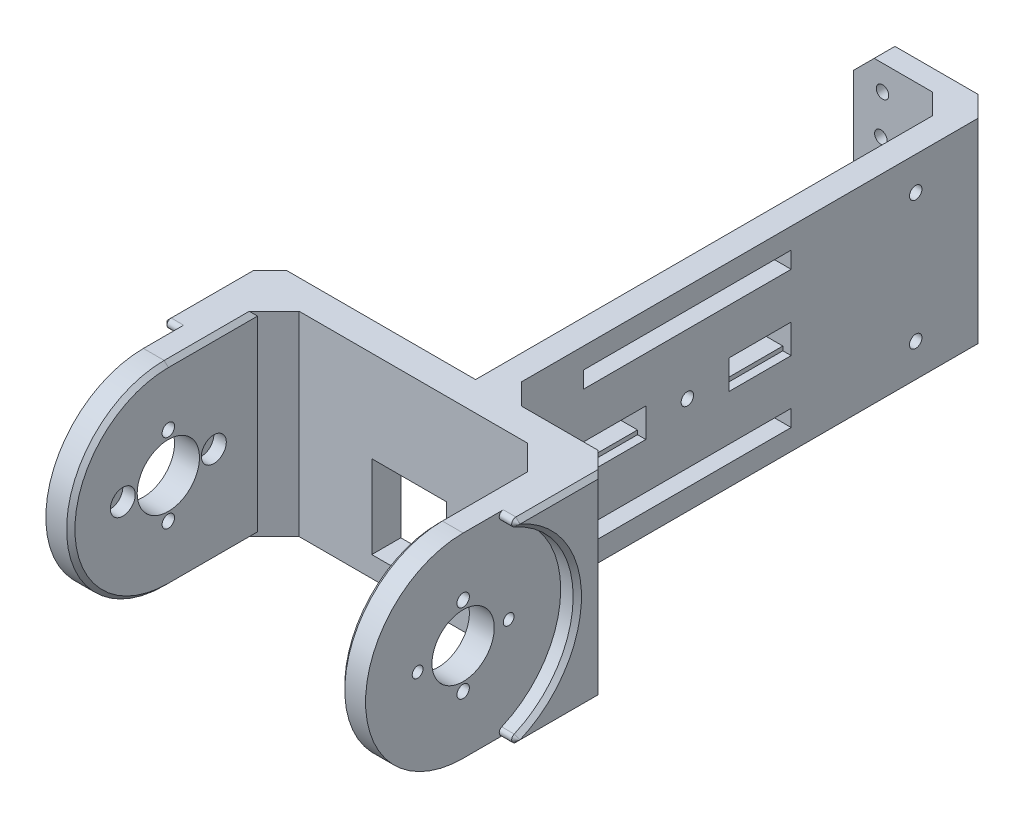
from build123d import *

# Parameters (mm, degrees)
BOSS_EXTRUDE1_DEPTH      = 47
SKETCH4_R                = 7.5
SKETCH4_R_2              = 1.3
SKETCH4_R_3              = 1.5
CUT_EXTRUDE1_DEPTH       = 178.603828403
BOSS_EXTRUDE3_START      = 4
BOSS_EXTRUDE3_DEPTH      = 4
BOSS_EXTRUDE4_DEPTH      = 4
CHAMFER2_SIZE            = 5
CHAMFER3_SIZE            = 5
FILLET1_START            = -43
FILLET1_DEPTH            = 5.085854664
FILLET1_START_2          = 39.085854664
FILLET1_2_DEPTH          = 4.914145336
SKETCH8_W                = 18
SKETCH8_H                = 20
CUT_EXTRUDE2_DEPTH       = 22
CHAMFER7_SIZE            = 5
SKETCH11_W               = 13.612021307
SKETCH11_H               = 35
CUT_EXTRUDE6_DEPTH       = 136.887419845
CHAMFER8_SIZE            = 5
CUT_EXTRUDE7_DEPTH       = 10
CUT_EXTRUDE7_DEPTH_BACK  = 12
SKETCH9_W                = 4
SKETCH9_H                = 21
SKETCH9_R                = 1.5
SKETCH9_6_W              = 12
SKETCH9_6_H              = 21
SKETCH9_6_R              = 1.5
CUT_EXTRUDE8_DEPTH       = 1
SKETCH14_R               = 1.5
SKETCH14_W               = 15
SKETCH14_H               = 5
SKETCH14_W_2             = 50
SKETCH14_H_2             = 4
CUT_EXTRUDE9_DEPTH       = 70
SKETCH15_W               = 15
SKETCH15_H               = 7
CUT_EXTRUDE10_DEPTH      = 2
CUT_EXTRUDE12_DEPTH      = 68
CUT_EXTRUDE12_DEPTH_BACK = 3
SKETCH16_R               = 3
CHAMFER9_SIZE            = 1
CHAMFER10_SIZE           = 1
SKETCH17_R               = 1.5
CUT_EXTRUDE13_DEPTH      = 10
CHAMFER11_SIZE           = 5
SKETCH18_R               = 1.5
CUT_EXTRUDE14_DEPTH      = 10


with BuildPart() as part:
    # Sketch1 → Boss-Extrude1 (new body)
    with BuildSketch(Plane(origin=(0, 0, 0), x_dir=(1, 0, 0), z_dir=(0, 1, 0))):
        Polygon((-31.914145336, -24.01268071), (-31.914145336, 25.98731929), (33.085854664, 25.98731929), (33.085854664, -24.01268071), (39.085854664, -24.01268071), (39.085854664, 32.98731929), (14.585854664, 32.98731929), (14.585854664, 152.98731929), (-15.414145336, 152.98731929), (-15.414145336, 147.98731929), (8.585854664, 147.98731929), (8.585854664, 32.98731929), (-37.914145336, 32.98731929), (-37.914145336, -24.01268071), align=None)
    extrude(amount=BOSS_EXTRUDE1_DEPTH)

    # Sketch4 → Cut-Extrude1 (cut, through all)
    with BuildSketch(Plane.ZY.offset(37.914145336)):
        with BuildLine():
            Line((24.01268071, 0), (24.01268071, 23.5))
            ThreePointArc((24.01268071, 23.5), (17.129690086, 6.88299066), (0.512680761, 0))
            Line((0.512680761, 0), (24.01268071, 0))
        make_face()
        with BuildLine():
            ThreePointArc((0.51268071, 47), (17.129690068, 40.117009358), (24.01268071, 23.5))
            Line((24.01268071, 23.5), (24.01268071, 47))
            Line((24.01268071, 47), (0.51268071, 47))
        make_face()
        with Locations((0.51268071, 23.5)):
            Circle(SKETCH4_R)
        with Locations((-10.44731929, 23.5)):
            Circle(SKETCH4_R_2)
        with Locations((11.472990927, 23.5)):
            Circle(SKETCH4_R_2)
        with Locations((0.51268071, 13.975)):
            Circle(SKETCH4_R_3)
        with Locations((0.51268071, 33.025)):
            Circle(SKETCH4_R_3)
    extrude(amount=-CUT_EXTRUDE1_DEPTH, mode=Mode.SUBTRACT)

    # Sketch4<4> → Boss-Extrude3 (add)
    with BuildSketch(Plane.ZY.offset(37.914145336).offset(BOSS_EXTRUDE3_START)):
        with BuildLine():
            ThreePointArc((0.512680761, 0), (-22.98731929, 23.499999975), (0.51268071, 47))
            Line((0.51268071, 47), (-32.98731929, 47))
            Line((-32.98731929, 47), (-32.98731929, 0))
            Line((-32.98731929, 0), (0.512680761, 0))
        make_face()
    extrude(amount=-BOSS_EXTRUDE3_DEPTH)

    # Sketch6 → Boss-Extrude4 (add)
    with BuildSketch(Plane(origin=(39.085854664, 0, 0), x_dir=(0, 0, -1), z_dir=(1, 0, 0))):
        with BuildLine():
            ThreePointArc((-0.51268071, 47), (16.104328648, 40.117009358), (22.98731929, 23.5))
            ThreePointArc((22.98731929, 23.5), (16.104328648, 6.882990642), (-0.51268071, 0))
            Line((-0.51268071, 0), (32.98731929, 0))
            Line((32.98731929, 0), (32.98731929, 47))
            Line((32.98731929, 47), (-0.51268071, 47))
        make_face()
    extrude(amount=BOSS_EXTRUDE4_DEPTH)

    # Chamfer2
    chamfer2_edges = [part.edges().sort_by_distance(p)[0] for p in [
        (-41.914145336, 23.5, -32.98731929),
        (43.085854664, 23.5, -32.98731929),
    ]]
    chamfer(chamfer2_edges, length=CHAMFER2_SIZE)

    # Chamfer3
    chamfer3_edges = [part.edges().sort_by_distance(p)[0] for p in [
        (33.085854664, 23.5, -25.98731929),
        (-31.914145336, 23.5, -25.98731929),
    ]]
    chamfer(chamfer3_edges, length=CHAMFER3_SIZE)

    # Fillet1: read off the stored shape, not the designer's step
    # Fillet1 outline → Fillet1 (cut)
    with BuildSketch(Plane.YZ.offset(FILLET1_START)):
        with BuildLine():
            ThreePointArc((0, -9.182679005), (0.797969491, -8.203299776), (1.918367347, -8.786950037))
            ThreePointArc((1.918367347, -8.786950037), (0.484588127, -4.235036249), (0, 0.51268071))
            Line((0, 0.51268071), (0, -9.182679005))
        make_face()
        with BuildLine():
            ThreePointArc((47, 0.51268071), (46.515411873, -4.235036249), (45.081632653, -8.786950037))
            ThreePointArc((45.081632653, -8.786950037), (46.202030509, -8.203299776), (47, -9.182679005))
            Line((47, -9.182679005), (47, 0.51268071))
        make_face()
    extrude(amount=FILLET1_DEPTH, mode=Mode.SUBTRACT)

    # Fillet1 2 outline → Fillet1 2 (cut)
    with BuildSketch(Plane.YZ.offset(FILLET1_START_2)):
        with BuildLine():
            ThreePointArc((0, -9.182679005), (0.797969491, -8.203299776), (1.918367347, -8.786950037))
            ThreePointArc((1.918367347, -8.786950037), (0.484588127, -4.235036249), (0, 0.51268071))
            Line((0, 0.51268071), (0, -9.182679005))
        make_face()
        with BuildLine():
            ThreePointArc((47, 0.51268071), (46.515411873, -4.235036249), (45.081632653, -8.786950037))
            ThreePointArc((45.081632653, -8.786950037), (46.202030509, -8.203299776), (47, -9.182679005))
            Line((47, -9.182679005), (47, 0.51268071))
        make_face()
    extrude(amount=FILLET1_2_DEPTH, mode=Mode.SUBTRACT)

    # Sketch8 → Cut-Extrude2 (cut)
    with BuildSketch(Plane(origin=(0, 0, -32.98731929), x_dir=(-1, 0, 0), z_dir=(0, 0, -1))):
        with Locations((0.414145336, 15)):
            Rectangle(SKETCH8_W, SKETCH8_H)
    extrude(amount=-CUT_EXTRUDE2_DEPTH, mode=Mode.SUBTRACT)

    # Chamfer7
    chamfer7_edges = [part.edges().sort_by_distance(p)[0] for p in [
        (14.585854664, 23.5, -32.98731929),
    ]]
    chamfer(chamfer7_edges, length=CHAMFER7_SIZE)

    # Sketch11 → Cut-Extrude6 (cut, through all)
    with BuildSketch(Plane(origin=(0, 0, -32.98731929), x_dir=(-1, 0, 0), z_dir=(0, 0, -1))):
        with Locations((-21.391865318, 23.5)):
            Rectangle(SKETCH11_W, SKETCH11_H)
    extrude(amount=CUT_EXTRUDE6_DEPTH, mode=Mode.SUBTRACT)

    # Chamfer8
    chamfer8_edges = [part.edges().sort_by_distance(p)[0] for p in [
        (8.585854664, 23.5, -147.98731929),
        (14.585854664, 23.5, -152.98731929),
    ]]
    chamfer(chamfer8_edges, length=CHAMFER8_SIZE)

    # Sketch9 → Cut-Extrude7 (cut, two sides: drawn at the far end of the back side and taken through both)
    with BuildSketch(Plane(origin=(155.073173954, 0, -152.98731929), x_dir=(1, 0, 0), z_dir=(0, 0, 1)).offset(-CUT_EXTRUDE7_DEPTH_BACK)):
        with Locations((-152.48731929, 23.5)):
            Rectangle(SKETCH9_W, SKETCH9_H)
        with Locations(Location((-163.88731929, 31.4, 0), (0, 0, 180))):
            Circle(SKETCH9_R)
        with Locations(Location((-163.88731929, 15.6, 0), (0, 0, 180))):
            Circle(SKETCH9_R)
    extrude(amount=CUT_EXTRUDE7_DEPTH + CUT_EXTRUDE7_DEPTH_BACK, mode=Mode.SUBTRACT)

    # Sketch9<6> → Cut-Extrude8 (cut)
    # profile 1 of 2: a face of its own
    with BuildSketch(Plane(origin=(155.073173954, 0, -152.98731929), x_dir=(1, 0, 0), z_dir=(0, 0, 1))):
        with Locations((-160.48731929, 23.5)):
            Rectangle(SKETCH9_6_W, SKETCH9_6_H)
        with Locations(Location((-163.88731929, 15.6, 0), (0, 0, 180))):
            Circle(SKETCH9_6_R, mode=Mode.SUBTRACT)
        with Locations(Location((-163.88731929, 31.4, 0), (0, 0, 180))):
            Circle(SKETCH9_6_R, mode=Mode.SUBTRACT)
    # profile 2 of 2: a face of its own
    with BuildSketch(Plane(origin=(155.073173954, 0, -152.98731929), x_dir=(1, 0, 0), z_dir=(0, 0, 1))):
        Polygon((-167.48731929, 35), (-150.48731929, 35), (-150.48731929, 34), (-166.48731929, 34), (-166.48731929, 13), (-150.48731929, 13), (-150.48731929, 12), (-167.48731929, 12), align=None)
    extrude(amount=CUT_EXTRUDE8_DEPTH, mode=Mode.SUBTRACT)

    # Sketch14 → Cut-Extrude9 (cut)
    with BuildSketch(Plane.ZY.offset(-8.585854664)):
        with Locations((-77.98731929, 23.5)):
            Circle(SKETCH14_R)
        with Locations((-95.48731929, 23.5)):
            Rectangle(SKETCH14_W, SKETCH14_H)
        with Locations((-60.48731929, 23.5)):
            Rectangle(SKETCH14_W, SKETCH14_H)
        with Locations((-77.98731929, 7)):
            Rectangle(SKETCH14_W_2, SKETCH14_H_2)
        with Locations((-77.98731929, 40)):
            Rectangle(SKETCH14_W_2, SKETCH14_H_2)
    extrude(amount=-CUT_EXTRUDE9_DEPTH, mode=Mode.SUBTRACT)

    # Sketch15 → Cut-Extrude10 (cut)
    with BuildSketch(Plane(origin=(14.585854664, 0, 0), x_dir=(0, 0, -1), z_dir=(1, 0, 0))):
        with Locations((95.48731929, 23.5)):
            Rectangle(SKETCH15_W, SKETCH15_H)
        with Locations((60.48731929, 23.5)):
            Rectangle(SKETCH15_W, SKETCH15_H)
    extrude(amount=-CUT_EXTRUDE10_DEPTH, mode=Mode.SUBTRACT)

    # Sketch16 → Cut-Extrude12 (cut, two sides: drawn at the far end of the back side and taken through both)
    with BuildSketch(Plane(origin=(-31.914145336, 0, 0), x_dir=(0, 0, -1), z_dir=(1, 0, 0)).offset(-CUT_EXTRUDE12_DEPTH_BACK)):
        with Locations((10.44731929, 23.5)):
            Circle(SKETCH16_R)
        with Locations((-11.472990927, 23.5)):
            Circle(SKETCH16_R)
    extrude(amount=CUT_EXTRUDE12_DEPTH + CUT_EXTRUDE12_DEPTH_BACK, mode=Mode.SUBTRACT)

    # Chamfer9
    chamfer9_edges = [part.edges().sort_by_distance(p)[0] for p in [
        (33.085854664, 0, -10.237319264),
        (33.085854664, 47, -10.23731929),
        (-31.914145336, 47, -10.23731929),
        (-31.914145336, 23.500000025, 24.01268071),
        (33.085854664, 23.500000025, 24.01268071),
        (-31.914145336, 0, -10.237319264),
    ]]
    chamfer(chamfer9_edges, length=CHAMFER9_SIZE)

    # Chamfer10
    chamfer10_edges = [part.edges().sort_by_distance(p)[0] for p in [
        (-41.914145336, 0, -18.584999147),
        (43.085854664, 47, -18.584999147),
        (-41.914145336, 23.5, -22.98731929),
        (43.085854664, 0, -18.584999147),
        (-41.914145336, 47, -18.584999147),
        (-41.914145336, 46.202030509, -8.203299776),
        (-41.914145336, 0.797969491, -8.203299776),
        (43.085854664, 23.5, -22.98731929),
        (43.085854664, 46.202030509, -8.203299776),
        (43.085854664, 0.797969491, -8.203299776),
    ]]
    chamfer(chamfer10_edges, length=CHAMFER10_SIZE - 0.0001)  # a hair under: the kernel refuses the full size

    # Sketch17 → Cut-Extrude13 (cut)
    with BuildSketch(Plane(origin=(0, 0, -152.98731929), x_dir=(-1, 0, 0), z_dir=(0, 0, -1))):
        with Locations((8.414145336, 41)):
            Circle(SKETCH17_R)
        with Locations((8.414145336, 6)):
            Circle(SKETCH17_R)
        with Locations((-7.585854664, 6)):
            Circle(SKETCH17_R)
        with Locations((-7.585854664, 41)):
            Circle(SKETCH17_R)
    extrude(amount=-CUT_EXTRUDE13_DEPTH, mode=Mode.SUBTRACT)

    # Chamfer11
    chamfer11_edges = [part.edges().sort_by_distance(p)[0] for p in [
        (-15.414145336, 0, -150.48731929),
        (-15.414145336, 47, -150.48731929),
    ]]
    chamfer(chamfer11_edges, length=CHAMFER11_SIZE)

    # Sketch18 → Cut-Extrude14 (cut)
    with BuildSketch(Plane(origin=(14.585854664, 0, 0), x_dir=(0, 0, -1), z_dir=(1, 0, 0))):
        with Locations((132.98731929, 39)):
            Circle(SKETCH18_R)
        with Locations((132.98731929, 8)):
            Circle(SKETCH18_R)
    extrude(amount=-CUT_EXTRUDE14_DEPTH, mode=Mode.SUBTRACT)


solid = part.part
